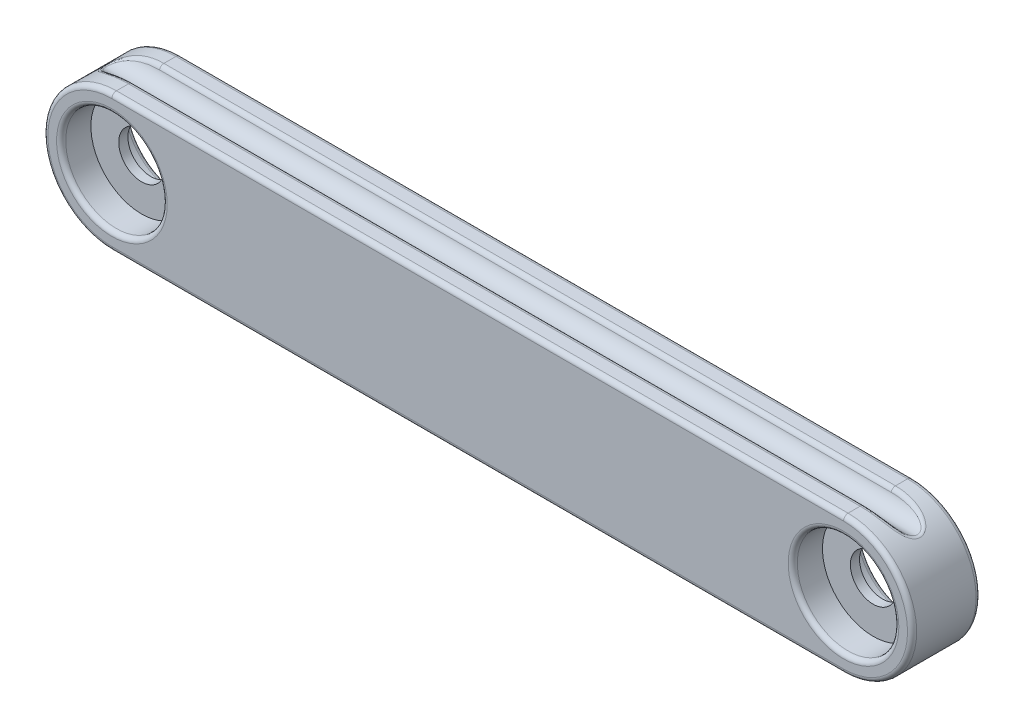
from build123d import *

# Parameters (mm, degrees)
SKETCH1_R               = 5
BOSS_EXTRUDE1_DEPTH     = 1
SKETCH1_3_R             = 11.1
BOSS_EXTRUDE2_DEPTH     = 7.5
CUT_EXTRUDE1_DEPTH      = 97.468906908
CUT_EXTRUDE1_DEPTH_BACK = 97.468906908
FILLET1_R               = 1
FILLET2_R               = 1


with BuildPart() as part:
    # Sketch1 → Boss-Extrude1 (new, symmetric)
    with BuildSketch(Plane.XY):
        with BuildLine():
            Line((80, 15), (-80, 15))
            ThreePointArc((-80, 15), (-95, 0), (-80, -15))
            Line((-80, -15), (80, -15))
            ThreePointArc((80, -15), (95, 0), (80, 15))
        make_face()
        with Locations((-80, 0)):
            Circle(SKETCH1_R, mode=Mode.SUBTRACT)
        with Locations((80, 0)):
            Circle(SKETCH1_R, mode=Mode.SUBTRACT)
    extrude(amount=BOSS_EXTRUDE1_DEPTH, both=True)

    # Sketch1<3> → Boss-Extrude2 (add, symmetric)
    with BuildSketch(Plane.XY):
        with BuildLine():
            Line((80, 15), (-80, 15))
            ThreePointArc((-80, 15), (-95, 0), (-80, -15))
            Line((-80, -15), (80, -15))
            ThreePointArc((80, -15), (95, 0), (80, 15))
        make_face()
        with Locations((-80, 0)):
            Circle(SKETCH1_3_R, mode=Mode.SUBTRACT)
        with Locations((80, 0)):
            Circle(SKETCH1_3_R, mode=Mode.SUBTRACT)
    extrude(amount=BOSS_EXTRUDE2_DEPTH, both=True)

    # Sketch2 → Cut-Extrude1 (cut, two sides: drawn at the far end of the back side and taken through both)
    with BuildSketch(Plane(origin=(0, 0, 0), x_dir=(0, 0, -1), z_dir=(1, 0, 0)).offset(-CUT_EXTRUDE1_DEPTH_BACK)):
        with BuildLine():
            Line((3, 15), (-3, 15))
            ThreePointArc((-3, 15), (0, 12), (3, 15))
        make_face()
    extrude(amount=CUT_EXTRUDE1_DEPTH + CUT_EXTRUDE1_DEPTH_BACK, mode=Mode.SUBTRACT)

    # Fillet1
    fillet1_edges = [part.edges().sort_by_distance(p)[0] for p in [
        (-89, 12, 0),
        (0, 15, 3),
        (88.9999999, 12.000000075, -0.000670821),
        (0, 15, -3),
    ]]
    fillet(fillet1_edges, radius=FILLET1_R)

    # Fillet2
    fillet2_edges = [part.edges().sort_by_distance(p)[0] for p in [
        (-95, 0, 7.5),
        (0, 15, 7.5),
        (95, 0, 7.5),
        (0, -15, 7.5),
        (-91.1, 0, 7.5),
        (68.9, 0, 7.5),
        (95, 0, -7.5),
        (0, 15, -7.5),
        (-95, 0, -7.5),
        (0, -15, -7.5),
        (-91.1, 0, -7.5),
        (68.9, 0, -7.5),
    ]]
    fillet(fillet2_edges, radius=FILLET2_R)


solid = part.part
